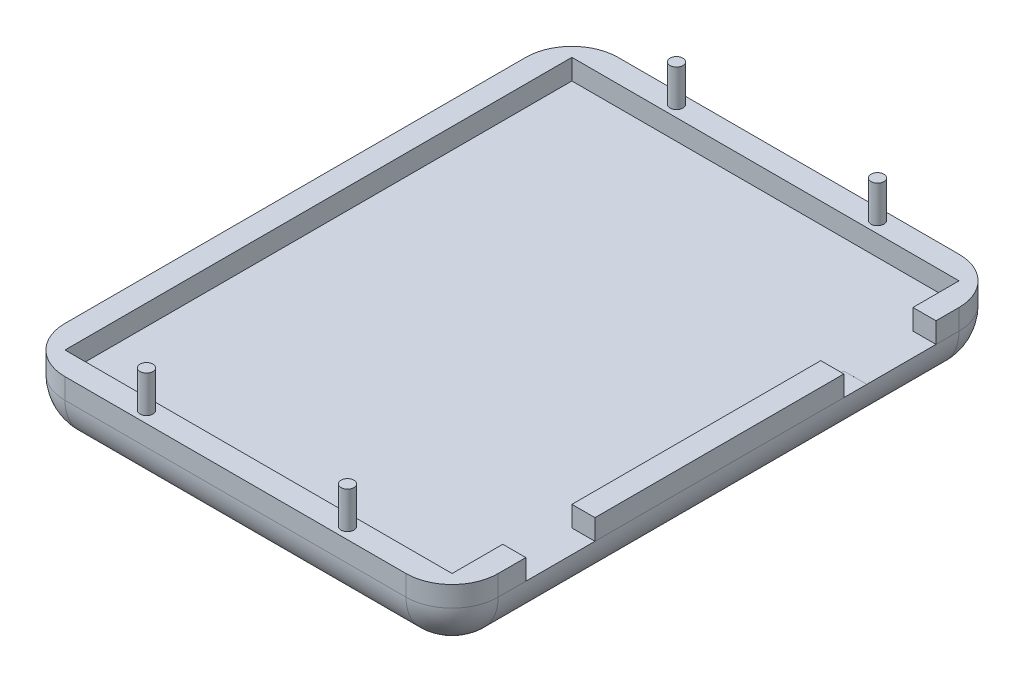
from build123d import *

# Parameters (mm, degrees)
SKETCH_1_W           = 94
SKETCH_1_H           = 30
EXTRUDE_2_DEPTH      = 120
SKETCH_2_W           = 84
SKETCH_2_H           = 110
CUT_EXTRUDE_1_DEPTH  = 20
SKETCH_4_W           = 12.8042226
SKETCH_4_H           = 20
CUT_EXTRUDE_5_DEPTH  = 20
SKETCH_9_W           = 17.034378807
SKETCH_9_H           = 15
CUT_EXTRUDE_6_DEPTH  = 20
SKETCH_10_W          = 26
SKETCH_10_H          = 34
EXTRUDE_2_2_DEPTH    = 26
SKETCH_16_R          = 11.5
CUT_EXTRUDE_8_DEPTH  = 126.231871204
FILLET_2_R           = 10
FILLET_3_R           = 10
FILLET_4_R           = 10
SKETCH_20_R          = 1.5
CUT_EXTRUDE_12_DEPTH = 10
SKETCH_21_W          = 28.864787598
SKETCH_21_H          = 27.787348415
CUT_EXTRUDE_13_DEPTH = 40
CUT_EXTRUDE_START    = -50
SKETCH_22_W          = 124.707119116
SKETCH_22_H          = 18.117072108
CUT_EXTRUDE_14_DEPTH = 150
SKETCH_23_R          = 1.4
EXTRUDE_4_DEPTH      = 8
SKETCH_25_W          = 5
SKETCH_25_H          = 5
CUT_EXTRUDE_15_DEPTH = 4.45
SKETCH_28_W          = 5
SKETCH_28_H          = 5
EXTRUDE_5_DEPTH      = 4.45


with BuildPart() as part:
    # 스케치1 → Extrude 2 (new body)
    with BuildSketch(Plane.XY):
        with Locations((47, 15)):
            Rectangle(SKETCH_1_W, SKETCH_1_H)
    extrude(amount=EXTRUDE_2_DEPTH)

    # 스케치2 → 컷-돌출1 (cut)
    with BuildSketch(Plane(origin=(0, 30, 0), x_dir=(1, 0, 0), z_dir=(0, 1, 0))):
        with Locations((47, -60)):
            Rectangle(SKETCH_2_W, SKETCH_2_H)
    extrude(amount=-CUT_EXTRUDE_1_DEPTH, mode=Mode.SUBTRACT)

    # 스케치4 → 컷-돌출5 (cut)
    with BuildSketch(Plane(origin=(0, 30, 0), x_dir=(1, 0, 0), z_dir=(0, 1, 0))):
        with Locations((95.4021113, -94)):
            Rectangle(SKETCH_4_W, SKETCH_4_H)
    extrude(amount=-CUT_EXTRUDE_5_DEPTH, mode=Mode.SUBTRACT)

    # 스케치9 → 컷-돌출6 (cut)
    with BuildSketch(Plane(origin=(0, 30, 0), x_dir=(1, 0, 0), z_dir=(0, 1, 0))):
        with Locations((97.517189403, -22.5)):
            Rectangle(SKETCH_9_W, SKETCH_9_H)
    extrude(amount=-CUT_EXTRUDE_6_DEPTH, mode=Mode.SUBTRACT)

    # 스케치10 → Extrude 2 2 (add)
    with BuildSketch(Plane(origin=(0, 0, 0), x_dir=(-1, 0, 0), z_dir=(0, -1, 0))):
        with Locations((-47, -59.883065639)):
            Rectangle(SKETCH_10_W, SKETCH_10_H)
    extrude(amount=EXTRUDE_2_2_DEPTH)

    # 스케치16 → 컷-돌출8 (cut, through all)
    with BuildSketch(Plane(origin=(0, 0, 42.883065639), x_dir=(-1, 0, 0), z_dir=(0, 0, -1))):
        with Locations((-47, -13)):
            Circle(SKETCH_16_R)
    extrude(amount=-CUT_EXTRUDE_8_DEPTH, mode=Mode.SUBTRACT)

    # 필렛2
    fillet_2_edges = [part.edges().sort_by_distance(p)[0] for p in [
        (0, 15, 0),
    ]]
    fillet(fillet_2_edges, radius=FILLET_2_R)

    # 필렛3
    fillet_3_edges = [part.edges().sort_by_distance(p)[0] for p in [
        (94, 15, 120),
        (0, 15, 120),
        (94, 15, 0),
    ]]
    fillet(fillet_3_edges, radius=FILLET_3_R)

    # 필렛4
    fillet_4_edges = [part.edges().sort_by_distance(p)[0] for p in [
        (47, 0, 0),
        (2.928932188, 0, 2.928932188),
        (0, 0, 60),
        (47, 0, 120),
        (94, 0, 60),
        (91.071067812, 0, 2.928932188),
        (91.071067812, 0, 117.071067812),
        (2.928932188, 0, 117.071067812),
    ]]
    fillet(fillet_4_edges, radius=FILLET_4_R - 0.0001)  # a hair under: the kernel refuses the full size

    # 스케치20 → 컷-돌출12 (cut)
    with BuildSketch(Plane(origin=(0, 30, 0), x_dir=(1, 0, 0), z_dir=(0, 1, 0))):
        with Locations(Location((25.192810861, -2.5, 0), (0, 0, 270))):
            Circle(SKETCH_20_R)
        with Locations(Location((68.807189139, -2.5, 0), (0, 0, 90))):
            Circle(SKETCH_20_R)
        with Locations(Location((25.192810861, -117.5, 0), (0, 0, 270))):
            Circle(SKETCH_20_R)
        with Locations(Location((68.807189139, -117.5, 0), (0, 0, 90))):
            Circle(SKETCH_20_R)
    extrude(amount=-CUT_EXTRUDE_12_DEPTH, mode=Mode.SUBTRACT)

    # 스케치21 → 컷-돌출13 (cut)
    with BuildSketch(Plane.XY.offset(76.883065639)):
        with Locations((48.432393799, -13.893674208)):
            Rectangle(SKETCH_21_W, SKETCH_21_H)
    extrude(amount=-CUT_EXTRUDE_13_DEPTH, mode=Mode.SUBTRACT)

    # 스케치22 → 컷-돌출14 (cut)
    with BuildSketch(Plane(origin=(5, 0, 0), x_dir=(0, 0, -1), z_dir=(1, 0, 0)).offset(CUT_EXTRUDE_START)):
        with Locations((-62.353559558, 23.504988421)):
            Rectangle(SKETCH_22_W, SKETCH_22_H)
    extrude(amount=CUT_EXTRUDE_14_DEPTH, mode=Mode.SUBTRACT)

    # 스케치23 → 보스-돌출4 (add)
    with BuildSketch(Plane(origin=(0, 14.446452367, 0), x_dir=(1, 0, 0), z_dir=(0, 1, 0))):
        with Locations(Location((25.192810861, -117.5, 0), (0, 0, 270))):
            Circle(SKETCH_23_R)
        with Locations(Location((68.807189139, -117.5, 0), (0, 0, 90))):
            Circle(SKETCH_23_R)
        with Locations(Location((25.192810861, -2.5, 0), (0, 0, 270))):
            Circle(SKETCH_23_R)
        with Locations(Location((68.807189139, -2.5, 0), (0, 0, 90))):
            Circle(SKETCH_23_R)
    extrude(amount=EXTRUDE_4_DEPTH)

    # 스케치25 → 컷-돌출15 (cut)
    with BuildSketch(Plane(origin=(0, 14.446452367, 0), x_dir=(1, 0, 0), z_dir=(0, 1, 0))):
        with Locations((91.5, -32.5)):
            Rectangle(SKETCH_25_W, SKETCH_25_H)
    extrude(amount=-CUT_EXTRUDE_15_DEPTH, mode=Mode.SUBTRACT)

    # 스케치28 → 보스-돌출5 (add)
    with BuildSketch(Plane(origin=(0, 14.446452367, 0), x_dir=(1, 0, 0), z_dir=(0, 1, 0))):
        with Locations((91.5, -86.5)):
            Rectangle(SKETCH_28_W, SKETCH_28_H)
    extrude(amount=-EXTRUDE_5_DEPTH)


solid = part.part
